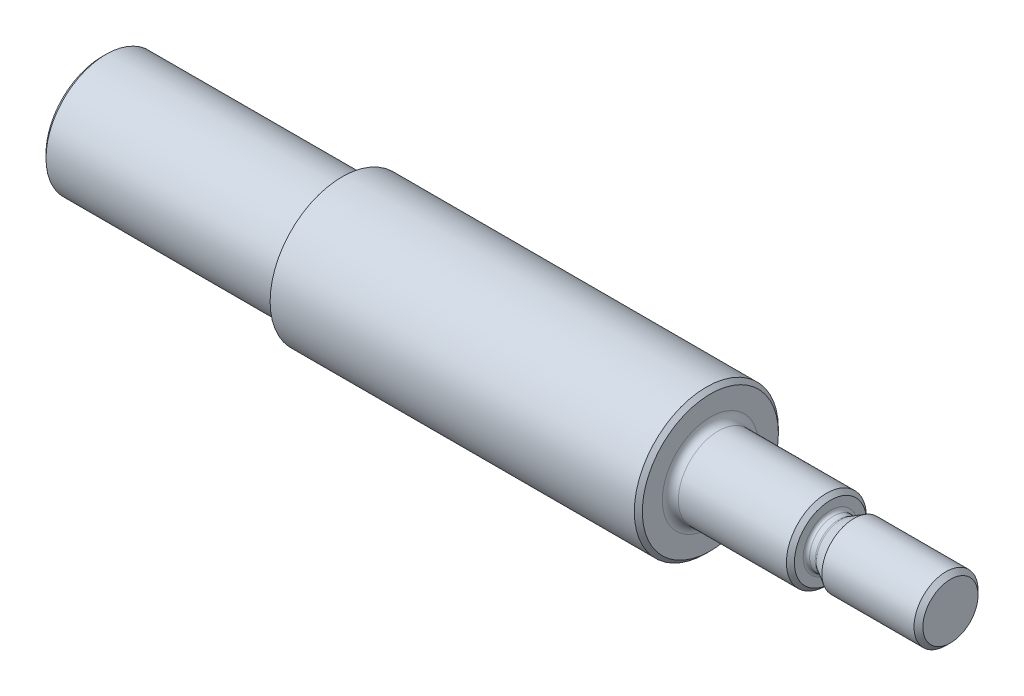
from build123d import *

# Parameters (mm, degrees)
FILLET1_R           = 1
CHAMFER1_SIZE       = 0.5
CHAMFER2_SIZE       = 0.5
SKETCH2_R           = 4.1
BOSS_EXTRUDE1_DEPTH = 15


# Read off the part's stored shape, not the designer's step: M8x1.0 Machine Threads Stud1
with BuildPart() as part:
    # Sketch1 → Revolve1 (revolve)
    with BuildSketch(Plane.XY, mode=Mode.PRIVATE) as revolve1_sk:
        Polygon((0, 0), (0, -7.5), (30, -7.5), (30, -9), (76, -9), (76, -5), (91, -5), (91, 0), align=None)
    revolve(revolve1_sk.sketch.rotate(Axis((0, 0, 0), (1, 0, 0)), 270), axis=Axis((0, 0, 0), (1, 0, 0)))

    # Fillet1
    fillet1_edges = [part.edges().sort_by_distance(p)[0] for p in [
        (76, 0, -5),
        (30, 0, -7.5),
    ]]
    fillet(fillet1_edges, radius=FILLET1_R)

    # Chamfer1
    chamfer1_edges = [part.edges().sort_by_distance(p)[0] for p in [
        (0, 0, -7.5),
    ]]
    chamfer(chamfer1_edges, length=CHAMFER1_SIZE)

    # Chamfer2
    chamfer2_edges = [part.edges().sort_by_distance(p)[0] for p in [
        (91, 0, -5),
        (76, 0, -9),
    ]]
    chamfer(chamfer2_edges, length=CHAMFER2_SIZE)

    # Sketch2 → Boss-Extrude1 (add)
    with BuildSketch(Plane(origin=(91, 0, 0), x_dir=(0, 0, -1), z_dir=(1, 0, 0))):
        Circle(SKETCH2_R)
    extrude(amount=BOSS_EXTRUDE1_DEPTH)

    # M8x1.0 Machine Threads Stud1 outline → M8x1.0 Machine Threads Stud1 (revolve, cut)
    with BuildSketch(Plane.YX):
        with BuildLine():
            ThreePointArc((3, 91.4), (3.117157288, 91.117157288), (3.4, 91))
            Line((3.4, 91), (4.1, 91))
            Line((4.1, 91), (4.1, 106))
            Line((4.1, 106), (3.4455, 106))
            Line((3.4455, 106), (4, 105.4455))
            Line((4, 105.4455), (4, 93.939230485))
            Line((4, 93.939230485), (3.053589838, 92.3))
            ThreePointArc((3.053589838, 92.3), (3.013629669, 92.203527618), (3, 92.1))
            Line((3, 92.1), (3, 91.4))
        make_face()
    revolve(axis=Axis((0, 0, 0), (1, 0, 0)), mode=Mode.SUBTRACT)


solid = part.part
